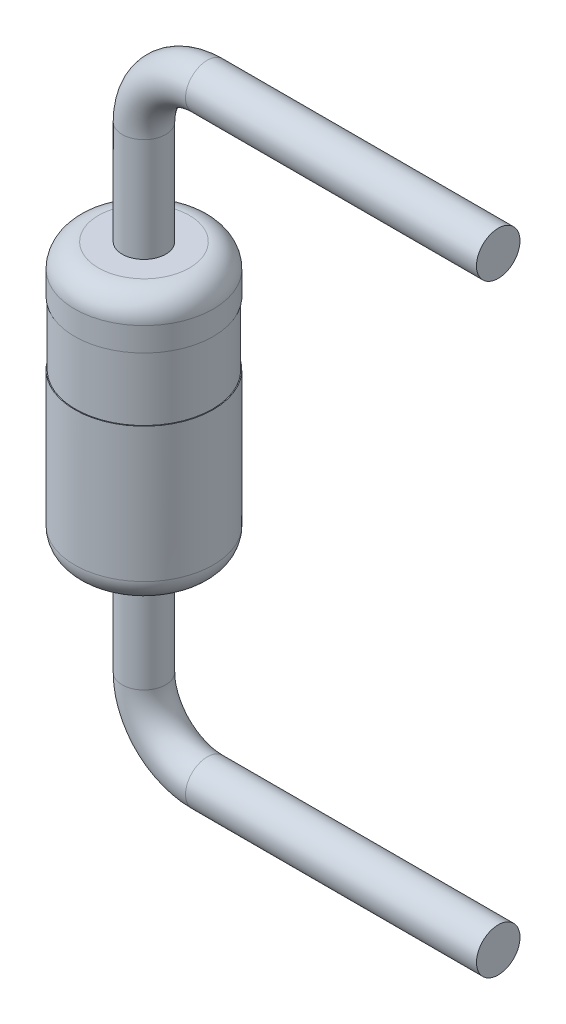
from build123d import *

# Parameters (mm, degrees)
ESQUISSE1_W           = 0.875
ESQUISSE1_H           = 1.7
CONG_1_R              = 0.3
ESQUISSE3_R           = 0.275
CONG_1_OF_SYM_TRIE1_R = 0.3
ESQUISSE4_W           = 0.01
ESQUISSE4_H           = 0.8


with BuildPart() as part:
    # Esquisse1 → Révolution1 (revolve)
    with BuildSketch(Plane.XY, mode=Mode.PRIVATE) as r_volution1_sk:
        with Locations((0.4375, 0.85)):
            Rectangle(ESQUISSE1_W, ESQUISSE1_H)
    r_volution1 = revolve(r_volution1_sk.sketch.rotate(Axis((0, 1.7, 0), (0, -1, 0)), 180), axis=Axis((0, 1.7, 0), (0, -1, 0)))

    # Congé1
    cong_1_edges = [part.edges().sort_by_distance(p)[0] for p in [
        (0.875, 1.7, 0),
    ]]
    fillet(cong_1_edges, radius=CONG_1_R)

    # Balayage1: sweep along a path in Esquisse2
    with BuildLine(Plane.XY) as balayage1_path:
        Line((0, 1.7), (0, 3.01))
        ThreePointArc((0, 3.01), (0.234314575, 3.575685425), (0.8, 3.81))
        Line((0.8, 3.81), (4.475, 3.81))
    # Esquisse3 → Balayage1 (sweep)
    with BuildSketch(Plane(origin=(0, 1.7, 0), x_dir=(1, 0, 0), z_dir=(0, 1, 0))):
        Circle(ESQUISSE3_R)
    balayage1 = sweep(path=balayage1_path.line)


with BuildPart() as sym_trie1_1:
    # Symétrie1: Révolution1, Balayage1 across Top Plane
    add(r_volution1.mirror(Plane(origin=(0, 0, 0), x_dir=(1, 0, 0), z_dir=(0, 1, 0))))
    add(balayage1.mirror(Plane(origin=(0, 0, 0), x_dir=(1, 0, 0), z_dir=(0, 1, 0))))

    # Congé1 of Symétrie1
    cong_1_of_sym_trie1_edges = [sym_trie1_1.edges().sort_by_distance(p)[0] for p in [
        (0.875, -1.7, 0),
    ]]
    fillet(cong_1_of_sym_trie1_edges, radius=CONG_1_OF_SYM_TRIE1_R)


with BuildPart() as part_1:
    add(part.part)

    # Symétrie1 united with what the copies to: union Symétrie1_1
    add(sym_trie1_1.part)

    # Esquisse4 → Enlèvement de matière-Révolution1 (revolve, cut)
    with BuildSketch(Plane.XY):
        with Locations((-0.87, 0.7)):
            Rectangle(ESQUISSE4_W, ESQUISSE4_H)
    revolve(axis=Axis((0, -1.4, 0), (0, 1, 0)), mode=Mode.SUBTRACT)


solid = part_1.part
